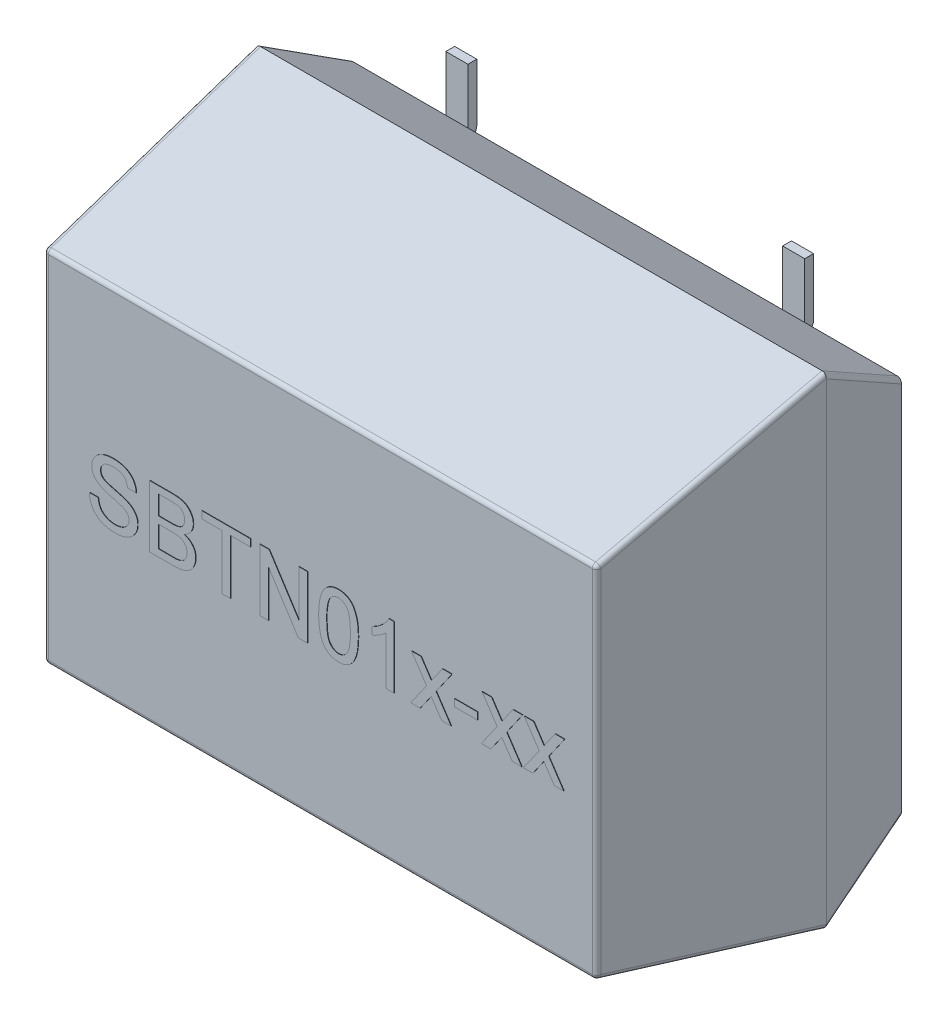
from build123d import *

# Parameters (mm, degrees)
EXTRUDE_1_DEPTH          = 6.45
CUT_EXTRUDE_1_DEPTH      = 12.03245213
CUT_EXTRUDE_1_DEPTH_BACK = 12.03245213
SKETCH_2_OUTSIDE_W       = 18.548
SKETCH_2_OUTSIDE_H       = 12.548
FILLET_1_R               = 0.1
EXTRUDE_2_DEPTH          = 0.25
PATTERN_START            = -1.52
PATTERN_LINEAR_1_DEPTH   = 0.5
SKETCH_4_W               = 0.52051282
SKETCH_4_H               = 0.161538461
EXTRUDE_3_DEPTH          = 0.01


with BuildPart() as part:
    # Эскиз1 → Бобышка-Вытянуть1 (new, symmetric)
    with BuildSketch(Plane(origin=(0, 0, 0), x_dir=(0, 0, -1), z_dir=(1, 0, 0))):
        Polygon((-0.2, -4.3), (-0.2, 4.3), (-2.1, 5.45), (-7.1, 4.05), (-7.1, -4.05), (-2.1, -5.45), align=None)
    extrude(amount=EXTRUDE_1_DEPTH, both=True)

    # Эскиз2 outside → Вырез-Вытянуть1 (cut, two sides: drawn at the far end of the back side and taken through both)
    with BuildSketch(Plane(origin=(0, 0, 0), x_dir=(1, 0, 0), z_dir=(0, 1, 0)).offset(-CUT_EXTRUDE_1_DEPTH_BACK)):
        with Locations((0, -3.65)):
            Rectangle(SKETCH_2_OUTSIDE_W, SKETCH_2_OUTSIDE_H)
        Polygon((-6.45, -2.1), (-6.25, -7.1), (6.25, -7.1), (6.45, -2.1), (6.25, -0.2), (-6.25, -0.2), align=None, mode=Mode.SUBTRACT)
    extrude(amount=CUT_EXTRUDE_1_DEPTH + CUT_EXTRUDE_1_DEPTH_BACK, mode=Mode.SUBTRACT)

    # Скругление1
    # the kernel refuses this fillet: 0.1 mm, written as the material it takes off along each edge
    with BuildSketch(Plane(origin=(6.153920032, -3.97415396, 7), x_dir=(-0.6939297237750098, -0.7200427337745576, 0), z_dir=(0.5236697259500523, -0.5046783631478613, 0.6863452250098288))) as fillet_1_piece_1_section:
        Polygon((-0.189675866, -0.189675866), (0.189675866, -0.189675866), (0.189675866, 0.189675866), (-0.189675866, 0.189675866), align=None)
    fillet_1_piece_1 = extrude(amount=0.189675866, mode=Mode.PRIVATE)
    fillet_1_piece_1 = split(fillet_1_piece_1, bisect_by=Plane(origin=(6.153920032, -3.97415396, 7), z_dir=(1, 0, 0)), keep=Keep.TOP, mode=Mode.PRIVATE)
    fillet_1_piece_1 = split(fillet_1_piece_1, bisect_by=Plane(origin=(6.153920032, -3.97415396, 7), z_dir=(-0.03849001794597494, 0.2694301256218253, 0.9622504486493764)), keep=Keep.TOP, mode=Mode.PRIVATE)
    fillet_1_piece_1 = split(fillet_1_piece_1, bisect_by=Plane(origin=(6.153920032, -3.97415396, 7), z_dir=(0, -1, 0)), keep=Keep.TOP, mode=Mode.PRIVATE)
    fillet_1_piece_1 = split(fillet_1_piece_1, bisect_by=Plane(origin=(6.153920032, -3.97415396, 7.1), z_dir=(0, 0, -1)), keep=Keep.TOP, mode=Mode.PRIVATE)
    fillet_1_piece_1 = split(fillet_1_piece_1, bisect_by=Plane(origin=(6.153920032, -4.070450362, 7.026962993), z_dir=(0, 0.9629640197141818, -0.26962992551997084)), keep=Keep.TOP, mode=Mode.PRIVATE)
    fillet_1_piece_1 = split(fillet_1_piece_1, bisect_by=Plane(origin=(6.253840128, -3.97415396, 7.003996804), z_dir=(-0.9992009587217895, 0, -0.039968038348871464)), keep=Keep.TOP, mode=Mode.PRIVATE)
    fillet_1_piece_1 = fillet_1_piece_1 - Plane(origin=(6.153920032, -3.97415396, 7), x_dir=(-0.5236697259500523, 0.5046783631478613, -0.6863452250098288), z_dir=(-0.6939297237750098, -0.7200427337745576, 0)) * Sphere(FILLET_1_R, mode=Mode.PRIVATE)
    add(fillet_1_piece_1, mode=Mode.SUBTRACT)
    with BuildSketch(Plane(origin=(-6.153920032, -3.97415396, 7), x_dir=(-0.02416515791510732, -0.7965200935815405, -0.6041289478776796), z_dir=(-0.5236697259500523, -0.5046783631478613, 0.6863452250098289))) as fillet_1_piece_2_section:
        Polygon((-0.189675866, -0.189675866), (0.189675866, -0.189675866), (0.189675866, 0.189675866), (-0.189675866, 0.189675866), align=None)
    fillet_1_piece_2 = extrude(amount=0.189675866, mode=Mode.PRIVATE)
    fillet_1_piece_2 = split(fillet_1_piece_2, bisect_by=Plane(origin=(-6.153920032, -3.97415396, 7), z_dir=(0, -1, 0)), keep=Keep.TOP, mode=Mode.PRIVATE)
    fillet_1_piece_2 = split(fillet_1_piece_2, bisect_by=Plane(origin=(-6.153920032, -3.97415396, 7), z_dir=(-1, 0, 0)), keep=Keep.TOP, mode=Mode.PRIVATE)
    fillet_1_piece_2 = split(fillet_1_piece_2, bisect_by=Plane(origin=(-6.153920032, -3.97415396, 7), z_dir=(0.03849001794597527, 0.2694301256218253, 0.9622504486493764)), keep=Keep.TOP, mode=Mode.PRIVATE)
    fillet_1_piece_2 = split(fillet_1_piece_2, bisect_by=Plane(origin=(-6.253840128, -3.97415396, 7.003996804), z_dir=(0.9992009587217895, 0, -0.039968038348871804)), keep=Keep.TOP, mode=Mode.PRIVATE)
    fillet_1_piece_2 = split(fillet_1_piece_2, bisect_by=Plane(origin=(-6.153920032, -3.97415396, 7.1), z_dir=(0, 0, -1)), keep=Keep.TOP, mode=Mode.PRIVATE)
    fillet_1_piece_2 = split(fillet_1_piece_2, bisect_by=Plane(origin=(-6.153920032, -4.070450362, 7.026962993), z_dir=(0, 0.9629640197141818, -0.26962992551997084)), keep=Keep.TOP, mode=Mode.PRIVATE)
    fillet_1_piece_2 = fillet_1_piece_2 - Plane(origin=(-6.153920032, -3.97415396, 7), x_dir=(0.5236697259500523, 0.5046783631478613, -0.6863452250098289), z_dir=(-0.02416515791510732, -0.7965200935815405, -0.6041289478776796)) * Sphere(FILLET_1_R, mode=Mode.PRIVATE)
    add(fillet_1_piece_2, mode=Mode.SUBTRACT)
    with BuildSketch(Plane(origin=(-6.153920032, 3.97415396, 7), x_dir=(0.024165157915107306, -0.7965200935815406, 0.6041289478776792), z_dir=(-0.5236697259500522, 0.5046783631478611, 0.6863452250098291))) as fillet_1_piece_3_section:
        Polygon((-0.189675866, -0.189675866), (0.189675866, -0.189675866), (0.189675866, 0.189675866), (-0.189675866, 0.189675866), align=None)
    fillet_1_piece_3 = extrude(amount=0.189675866, mode=Mode.PRIVATE)
    fillet_1_piece_3 = split(fillet_1_piece_3, bisect_by=Plane(origin=(-6.153920032, 3.97415396, 7), z_dir=(0, 1, 0)), keep=Keep.TOP, mode=Mode.PRIVATE)
    fillet_1_piece_3 = split(fillet_1_piece_3, bisect_by=Plane(origin=(-6.153920032, 3.97415396, 7), z_dir=(-1, 0, 0)), keep=Keep.TOP, mode=Mode.PRIVATE)
    fillet_1_piece_3 = split(fillet_1_piece_3, bisect_by=Plane(origin=(-6.153920032, 3.97415396, 7), z_dir=(0.038490017945975265, -0.26943012562182567, 0.9622504486493763)), keep=Keep.TOP, mode=Mode.PRIVATE)
    fillet_1_piece_3 = split(fillet_1_piece_3, bisect_by=Plane(origin=(-6.253840128, 3.97415396, 7.003996804), z_dir=(0.9992009587217895, 0, -0.039968038348871804)), keep=Keep.TOP, mode=Mode.PRIVATE)
    fillet_1_piece_3 = split(fillet_1_piece_3, bisect_by=Plane(origin=(-6.153920032, 3.97415396, 7.1), z_dir=(0, 0, -1)), keep=Keep.TOP, mode=Mode.PRIVATE)
    fillet_1_piece_3 = split(fillet_1_piece_3, bisect_by=Plane(origin=(-6.153920032, 4.070450362, 7.026962993), z_dir=(0, -0.9629640197141817, -0.2696299255199712)), keep=Keep.TOP, mode=Mode.PRIVATE)
    fillet_1_piece_3 = fillet_1_piece_3 - Plane(origin=(-6.153920032, 3.97415396, 7), x_dir=(0.5236697259500522, -0.5046783631478611, -0.6863452250098291), z_dir=(0.024165157915107306, -0.7965200935815406, 0.6041289478776792)) * Sphere(FILLET_1_R, mode=Mode.PRIVATE)
    add(fillet_1_piece_3, mode=Mode.SUBTRACT)
    with BuildSketch(Plane(origin=(6.153920032, 3.97415396, 7), x_dir=(0.6939297237750099, -0.7200427337745575, 0), z_dir=(0.5236697259500523, 0.5046783631478612, 0.686345225009829))) as fillet_1_piece_4_section:
        Polygon((-0.189675866, -0.189675866), (0.189675866, -0.189675866), (0.189675866, 0.189675866), (-0.189675866, 0.189675866), align=None)
    fillet_1_piece_4 = extrude(amount=0.189675866, mode=Mode.PRIVATE)
    fillet_1_piece_4 = split(fillet_1_piece_4, bisect_by=Plane(origin=(6.153920032, 3.97415396, 7), z_dir=(0, 1, 0)), keep=Keep.TOP, mode=Mode.PRIVATE)
    fillet_1_piece_4 = split(fillet_1_piece_4, bisect_by=Plane(origin=(6.153920032, 3.97415396, 7), z_dir=(-0.03849001794597494, -0.26943012562182567, 0.9622504486493763)), keep=Keep.TOP, mode=Mode.PRIVATE)
    fillet_1_piece_4 = split(fillet_1_piece_4, bisect_by=Plane(origin=(6.153920032, 3.97415396, 7), z_dir=(1, 0, 0)), keep=Keep.TOP, mode=Mode.PRIVATE)
    fillet_1_piece_4 = split(fillet_1_piece_4, bisect_by=Plane(origin=(6.153920032, 3.97415396, 7.1), z_dir=(0, 0, -1)), keep=Keep.TOP, mode=Mode.PRIVATE)
    fillet_1_piece_4 = split(fillet_1_piece_4, bisect_by=Plane(origin=(6.253840128, 3.97415396, 7.003996804), z_dir=(-0.9992009587217895, 0, -0.039968038348871464)), keep=Keep.TOP, mode=Mode.PRIVATE)
    fillet_1_piece_4 = split(fillet_1_piece_4, bisect_by=Plane(origin=(6.153920032, 4.070450362, 7.026962993), z_dir=(0, -0.9629640197141817, -0.2696299255199712)), keep=Keep.TOP, mode=Mode.PRIVATE)
    fillet_1_piece_4 = fillet_1_piece_4 - Plane(origin=(6.153920032, 3.97415396, 7), x_dir=(-0.5236697259500523, -0.5046783631478612, -0.686345225009829), z_dir=(0.6939297237750099, -0.7200427337745575, 0)) * Sphere(FILLET_1_R, mode=Mode.PRIVATE)
    add(fillet_1_piece_4, mode=Mode.SUBTRACT)
    with BuildSketch(Plane(origin=(6.153920032, -4.05, 7.1), x_dir=(0, -0.26962992551997217, -0.9629640197141813), z_dir=(-1, 0, 0)), Plane(origin=(-6.153920032, 4.05, 7.1), x_dir=(0, 0.2696299255199674, -0.9629640197141828), z_dir=(1, 0, 0))) as fillet_1_piece_5:
        with BuildLine():
            CenterArc((FILLET_1_R * 0.75846039886, -FILLET_1_R), FILLET_1_R, 90, 74.357753543)
            Line((-FILLET_1_R * 0.204503620854, -FILLET_1_R * 0.73037007448), (0, 0))
            Line((0, 0), (FILLET_1_R * 0.75846039886, 0))
        make_face()
    extrude(amount=12.307840064, mode=Mode.SUBTRACT)
    with BuildSketch(Plane(origin=(-6.25, -3.97415396, 7.1), x_dir=(-0.03996803834887342, 0, -0.9992009587217894), z_dir=(0, 1, 0))) as fillet_1_piece_6:
        with BuildLine():
            CenterArc((FILLET_1_R * 0.960799680256, -FILLET_1_R), FILLET_1_R, 90, 87.709389957)
            Line((-FILLET_1_R * 0.038401278466, -FILLET_1_R * 0.960031961651), (0, 0))
            Line((0, 0), (FILLET_1_R * 0.960799680256, 0))
        make_face()
    extrude(amount=7.94830792, mode=Mode.SUBTRACT)
    with BuildSketch(Plane(origin=(6.5561911, -6.060598827, 3.108815454), x_dir=(-0.9959697569011013, -0.046441570012610664, 0.07672955045564107), z_dir=(-0.08968970586617502, 0.5157158087305063, -0.8520522057286626)), Plane(origin=(-6.22876178, -4.177880235, -0.001763091), x_dir=(0.9959697569011013, -0.046441570012620684, 0.07672955045563509), z_dir=(-0.0896897058661751, -0.5157158087305062, 0.8520522057286625)), Plane(origin=(-6.5561911, 6.060598827, 3.108815454), x_dir=(0.9959697569011015, 0.04644157001262381, 0.07672955045563323), z_dir=(0.08968970586617511, -0.5157158087305062, -0.8520522057286626))) as fillet_1_piece_7:
        with BuildLine():
            CenterArc((FILLET_1_R * 0.947186519515, FILLET_1_R), FILLET_1_R, 183.107301536, 86.892698464)
            Line((-FILLET_1_R * 0.0513432511233, FILLET_1_R * 0.945793938084), (0, 0))
            Line((0, 0), (FILLET_1_R * 0.947186519515, 0))
        make_face()
    extrude(amount=3.650690091, mode=Mode.SUBTRACT)
    with BuildSketch(Plane(origin=(6.25, -3.97415396, 7.1), x_dir=(0.03996803834887305, 0, -0.9992009587217894), z_dir=(0, 1, 0))) as fillet_1_piece_8:
        with BuildLine():
            CenterArc((FILLET_1_R * 0.960799680256, FILLET_1_R), FILLET_1_R, 182.290610043, 87.709389957)
            Line((-FILLET_1_R * 0.038401278466, FILLET_1_R * 0.960031961651), (0, 0))
            Line((0, 0), (FILLET_1_R * 0.960799680256, 0))
        make_face()
    extrude(amount=7.94830792, mode=Mode.SUBTRACT)
    with BuildSketch(Plane(origin=(6.478558079, 5.649906551, 1.386048031), x_dir=(0.01076859359318294, -0.9630199413342423, -0.26921483982986083), z_dir=(-0.03849001794597494, -0.26943012562182567, 0.9622504486493763))) as fillet_1_piece_9:
        with BuildLine():
            CenterArc((FILLET_1_R * 0.989280867363, -FILLET_1_R), FILLET_1_R, 90, 89.382535542)
            Line((-FILLET_1_R * 0.0106610636213, -FILLET_1_R * 0.989223420797), (0, 0))
            Line((0, 0), (FILLET_1_R * 0.989280867363, 0))
        make_face()
    extrude(amount=5.866021356, mode=Mode.SUBTRACT)
    with BuildSketch(Plane(origin=(-6.252774811, 4.06942368, 7.030629713), x_dir=(0.9992589847074272, 0.010378060672033654, -0.03706450240012789), z_dir=(-0.038490017945975265, 0.26943012562182567, -0.9622504486493763)), Plane(origin=(6.252774811, -4.06942368, 7.030629713), x_dir=(-0.9992589847074272, -0.010378060672022911, -0.03706450240013056), z_dir=(0.03849001794597494, -0.2694301256218253, -0.9622504486493764)), Plane(origin=(-6.478558079, -5.649906551, 1.386048031), x_dir=(0.9992589847074272, -0.010378060672023, -0.03706450240013088), z_dir=(0.03849001794597527, 0.2694301256218253, 0.9622504486493764))) as fillet_1_piece_10:
        with BuildLine():
            CenterArc((FILLET_1_R * 0.989280867363, FILLET_1_R), FILLET_1_R, 180.617464458, 89.382535542)
            Line((-FILLET_1_R * 0.0106610636213, FILLET_1_R * 0.989223420797), (0, 0))
            Line((0, 0), (FILLET_1_R * 0.989280867363, 0))
        make_face()
    extrude(amount=5.866021356, mode=Mode.SUBTRACT)
    with BuildSketch(Plane(origin=(6.22876178, 4.177880235, -0.001763091), x_dir=(0.05398759830949531, -0.8567597123029538, 0.5128821839402616), z_dir=(0.08968970586617502, 0.515715808730506, 0.8520522057286626))) as fillet_1_piece_11:
        with BuildLine():
            CenterArc((FILLET_1_R * 0.947186519515, -FILLET_1_R), FILLET_1_R, 90, 86.892698464)
            Line((-FILLET_1_R * 0.0513432511233, -FILLET_1_R * 0.945793938084), (0, 0))
            Line((0, 0), (FILLET_1_R * 0.947186519515, 0))
        make_face()
    extrude(amount=3.650690091, mode=Mode.SUBTRACT)

    # Эскиз3 → Бобышка-Вытянуть2 (add, symmetric)
    with BuildSketch(Plane(origin=(-3.81, 0, 0), x_dir=(0, 0, -1), z_dir=(1, 0, 0))):
        with BuildLine():
            Line((0, -5.55), (0, -4.25))
            ThreePointArc((0, -4.25), (-0.058578644, -4.108578644), (-0.2, -4.05))
            Line((-0.2, -4.05), (-0.2, -5.55))
            Line((-0.2, -5.55), (0, -5.55))
        make_face()
        with BuildLine():
            Line((0, 4.25), (0, 5.55))
            Line((0, 5.55), (-0.2, 5.55))
            Line((-0.2, 5.55), (-0.2, 4.05))
            ThreePointArc((-0.2, 4.05), (-0.058578644, 4.108578644), (0, 4.25))
        make_face()
    extrude_2 = extrude(amount=EXTRUDE_2_DEPTH, both=True)

    # Зеркальное отражение1: Бобышка-Вытянуть2 across plane
    add(extrude_2.mirror(Plane(origin=(0, 0, 0), x_dir=(0, 0, 1), z_dir=(1, 0, 0))))

    # Линейный массив1: read off the stored shape, not the designer's step
    # Линейный массив1 outline → Линейный массив1 (add)
    with BuildSketch(Plane.YZ.offset(PATTERN_START)):
        with BuildLine():
            ThreePointArc((-4.25, 0), (-4.108578644, 0.058578644), (-4.05, 0.2))
            Line((-4.05, 0.2), (-5.55, 0.2))
            Line((-5.55, 0.2), (-5.55, 0))
            Line((-5.55, 0), (-4.25, 0))
        make_face()
    extrude(amount=PATTERN_LINEAR_1_DEPTH)

    # Эскиз4 → Бобышка-Вытянуть3 (add)
    # profile 1 of 10: a face of its own
    with BuildSketch(Plane.XY.offset(7.1)):
        with BuildLine():
            Line((-5.213856683, -0.21238341), (-5.016420785, -0.21238341))
            add(Edge.make_bspline(
                [(-5.016420785, -0.21238341), (-5.014249105, -0.230110438), (-5.01007719, -0.264165015), (-4.998412099, -0.312432251), (-4.983398375, -0.355829449), (-4.964691689, -0.394932568), (-4.940083755, -0.429272763), (-4.910435428, -0.460247094), (-4.874429149, -0.48706899), (-4.833786267, -0.510938719), (-4.78852144, -0.529680232), (-4.740197199, -0.543573624), (-4.689044011, -0.55180557), (-4.654017455, -0.552867044), (-4.636132324, -0.553409051)],
                knots=[0, 0, 0, 0, 1.125557648, 2.162256852, 3.1243583, 4.018160113, 4.88511607, 5.777380551, 6.711250965, 7.707237736, 8.743031335, 9.791730543, 10.872421559, 12, 12, 12, 12], degree=3))
            add(Edge.make_bspline(
                [(-4.636132324, -0.553409051), (-4.620305523, -0.553116113), (-4.589446326, -0.552544942), (-4.544805048, -0.545683765), (-4.502797476, -0.53595137), (-4.464205415, -0.521229598), (-4.429171226, -0.503352751), (-4.398747957, -0.481730285), (-4.372774189, -0.457346083), (-4.352434846, -0.429557879), (-4.336456664, -0.400440488), (-4.324735016, -0.370510813), (-4.317752671, -0.339934977), (-4.316862938, -0.319361979), (-4.316420785, -0.309138217)],
                knots=[0, 0, 0, 0, 1.267006637, 2.470417599, 3.611360613, 4.716023143, 5.771382139, 6.754486395, 7.697536124, 8.612899418, 9.501261124, 10.352596716, 11.181322154, 12, 12, 12, 12], degree=3))
            add(Edge.make_bspline(
                [(-4.316420785, -0.309138217), (-4.316893455, -0.299018017), (-4.317817287, -0.279238099), (-4.323837646, -0.25044101), (-4.33528019, -0.224083309), (-4.350128204, -0.199089197), (-4.370784328, -0.176237497), (-4.396881009, -0.155181694), (-4.428993223, -0.136092299), (-4.45296016, -0.125637833), (-4.465619503, -0.120115781)],
                knots=[0, 0, 0, 0, 0.942140154, 1.841411588, 2.718743672, 3.605002079, 4.535543111, 5.568170452, 6.715506882, 8, 8, 8, 8], degree=3))
            add(Edge.make_bspline(
                [(-4.465619503, -0.120115781), (-4.470551771, -0.118091742), (-4.481694659, -0.113519068), (-4.500793046, -0.107465636), (-4.523455701, -0.09963793), (-4.550227076, -0.091576667), (-4.580963852, -0.083048978), (-4.615614855, -0.073396927), (-4.654160724, -0.063132499), (-4.695508229, -0.052207134), (-4.737256611, -0.041097713), (-4.777142311, -0.029977888), (-4.813839052, -0.018689841), (-4.847647429, -0.007821011), (-4.878393144, 0.003092661), (-4.906163461, 0.013752381), (-4.930993003, 0.023941878), (-4.946157942, 0.031434059), (-4.953319824, 0.03497236)],
                knots=[0, 0, 0, 0, 0.499201778, 1.127787504, 1.87543728, 2.745208432, 3.745951656, 4.863402235, 6.114490242, 7.482339553, 8.869366102, 10.161191451, 11.360587006, 12.46547846, 13.487450326, 14.41601931, 15.251940103, 16, 16, 16, 16], degree=3))
            add(Edge.make_bspline(
                [(-4.953319824, 0.03497236), (-4.969797316, 0.043873976), (-5.001603165, 0.061056412), (-5.044410315, 0.091778655), (-5.080479685, 0.12587067), (-5.109659104, 0.163283022), (-5.132525873, 0.203382979), (-5.147953983, 0.24623871), (-5.158520964, 0.291072305), (-5.159508476, 0.32190243), (-5.160010529, 0.337576526)],
                knots=[0, 0, 0, 0, 1.158441928, 2.236094408, 3.251151369, 4.220012324, 5.163146324, 6.095083285, 7.031536583, 8, 8, 8, 8], degree=3))
            add(Edge.make_bspline(
                [(-5.160010529, 0.337576526), (-5.159344205, 0.354932941), (-5.158018891, 0.389454723), (-5.146262629, 0.440113286), (-5.127511166, 0.488860298), (-5.106166307, 0.527561266), (-5.085350353, 0.556826765), (-5.068093769, 0.577903243), (-5.048737134, 0.597385612), (-5.027876567, 0.615545835), (-5.005139162, 0.632112577), (-4.981089039, 0.647766709), (-4.954855715, 0.661221811), (-4.917993994, 0.67834712), (-4.868681893, 0.695448341), (-4.806604126, 0.710349887), (-4.741269315, 0.719125097), (-4.696735572, 0.720333044), (-4.673992901, 0.720949924)],
                knots=[0, 0, 0, 0, 1.199927478, 2.386647047, 3.578628709, 4.806592355, 5.433127754, 6.062729195, 6.689531802, 7.331674828, 7.974827539, 8.635320743, 9.315455226, 10.01318112, 11.447700238, 12.918145351, 14.426146008, 16, 16, 16, 16], degree=3))
            add(Edge.make_bspline(
                [(-4.673992901, 0.720949924), (-4.649099536, 0.72037953), (-4.600627358, 0.719268864), (-4.530195914, 0.710028326), (-4.464502658, 0.694159891), (-4.412983753, 0.676396769), (-4.374896429, 0.658414019), (-4.347838133, 0.644382261), (-4.322722684, 0.628158993), (-4.299323992, 0.610602879), (-4.277424714, 0.591721937), (-4.257587712, 0.571067052), (-4.238951608, 0.549342931), (-4.217051588, 0.518153899), (-4.193438724, 0.476875391), (-4.173022188, 0.423397446), (-4.158995791, 0.366955865), (-4.156267333, 0.327936355), (-4.154882324, 0.308129411)],
                knots=[0, 0, 0, 0, 1.607600973, 3.130308851, 4.577334065, 5.967726088, 6.640410691, 7.296826776, 7.935019992, 8.569057421, 9.185393759, 9.8003086, 10.417295362, 11.032210203, 12.259799365, 13.477607022, 14.719591916, 16, 16, 16, 16], degree=3))
            Line((-4.154882324, 0.308129411), (-4.352318221, 0.308129411))
            add(Edge.make_bspline(
                [(-4.352318221, 0.308129411), (-4.3535727, 0.318154284), (-4.356027343, 0.337769991), (-4.362116986, 0.366166676), (-4.37065344, 0.39254024), (-4.380652244, 0.417136633), (-4.392772887, 0.439700027), (-4.40690205, 0.460447078), (-4.423211796, 0.479133351), (-4.441282458, 0.49625261), (-4.461663923, 0.511158705), (-4.484251464, 0.524097654), (-4.50908321, 0.535028102), (-4.536137285, 0.543980496), (-4.565419044, 0.550921832), (-4.596995089, 0.556028012), (-4.630853215, 0.558643115), (-4.65417078, 0.559150835), (-4.666140337, 0.559411462)],
                knots=[0, 0, 0, 0, 1.074487479, 2.102453544, 3.083708351, 4.020042547, 4.923259678, 5.803182661, 6.684453325, 7.556870173, 8.445961597, 9.363679789, 10.320905216, 11.327237703, 12.390948353, 13.519046902, 14.726457512, 16, 16, 16, 16], degree=3))
            add(Edge.make_bspline(
                [(-4.666140337, 0.559411462), (-4.678582133, 0.559317682), (-4.70266639, 0.559136146), (-4.737482914, 0.555826976), (-4.769753333, 0.551286678), (-4.799422216, 0.544589352), (-4.826392374, 0.53582253), (-4.851064081, 0.525698861), (-4.872746875, 0.51286953), (-4.891946217, 0.498579323), (-4.908508082, 0.482767999), (-4.922781956, 0.466106685), (-4.935406095, 0.449084905), (-4.94521533, 0.430772235), (-4.953201521, 0.411862205), (-4.958353492, 0.391999368), (-4.962001208, 0.371551135), (-4.962380849, 0.357598896), (-4.962574631, 0.350477167)],
                knots=[0, 0, 0, 0, 1.464176581, 2.834285765, 4.113735764, 5.29917439, 6.409476712, 7.449999357, 8.431575861, 9.367089851, 10.262376129, 11.120706676, 11.948504824, 12.751342953, 13.560717798, 14.359016663, 15.162382702, 16, 16, 16, 16], degree=3))
            add(Edge.make_bspline(
                [(-4.962574631, 0.350477167), (-4.962064411, 0.338432183), (-4.961074119, 0.315053978), (-4.950961794, 0.281840597), (-4.935408967, 0.251564447), (-4.920086955, 0.235091349), (-4.912374311, 0.226799283)],
                knots=[0, 0, 0, 0, 1.050964922, 2.039826012, 3.013306874, 4, 4, 4, 4], degree=3))
            add(Edge.make_bspline(
                [(-4.912374311, 0.226799283), (-4.907512342, 0.222655305), (-4.896760399, 0.213491153), (-4.876754751, 0.201363472), (-4.851950715, 0.189109995), (-4.822182553, 0.176929091), (-4.787501484, 0.164672885), (-4.747963448, 0.152053614), (-4.703417849, 0.139520318), (-4.655222214, 0.127442414), (-4.606533385, 0.115315955), (-4.560262628, 0.103235714), (-4.517778241, 0.09178697), (-4.479147629, 0.080620596), (-4.444330807, 0.069768166), (-4.413448777, 0.059002307), (-4.386251691, 0.049100448), (-4.369590263, 0.042133681), (-4.361853478, 0.038898642)],
                knots=[0, 0, 0, 0, 0.523891492, 1.158553688, 1.913783773, 2.794766643, 3.797521443, 4.933638669, 6.202080764, 7.596537849, 9.013317056, 10.322179469, 11.523240428, 12.626146501, 13.623953177, 14.517289671, 15.311498917, 16, 16, 16, 16], degree=3))
            add(Edge.make_bspline(
                [(-4.361853478, 0.038898642), (-4.351787527, 0.034257592), (-4.332029754, 0.02514799), (-4.304040222, 0.009594714), (-4.277922953, -0.006556525), (-4.253888955, -0.023740574), (-4.232015943, -0.041993579), (-4.212059351, -0.061106401), (-4.193898648, -0.080971622), (-4.178266617, -0.102225045), (-4.164230656, -0.124007512), (-4.151948256, -0.146623459), (-4.142058703, -0.170205888), (-4.133384949, -0.194470534), (-4.127146032, -0.219687289), (-4.122253462, -0.245601449), (-4.119399708, -0.272334818), (-4.119124357, -0.290435002), (-4.118984888, -0.299602961)],
                knots=[0, 0, 0, 0, 1.198900896, 2.353241543, 3.461831299, 4.520043694, 5.547003373, 6.541368882, 7.508191797, 8.454912692, 9.392021408, 10.310662301, 11.235020644, 12.156274873, 13.095836685, 14.042125239, 15.00831306, 16, 16, 16, 16], degree=3))
            add(Edge.make_bspline(
                [(-4.118984888, -0.299602961), (-4.119715521, -0.317899716), (-4.121166072, -0.354224855), (-4.133655833, -0.407769791), (-4.153276587, -0.459654535), (-4.176286782, -0.500827938), (-4.198038371, -0.532278434), (-4.216310731, -0.554883613), (-4.236573729, -0.575785546), (-4.258328509, -0.59563905), (-4.281743976, -0.61403905), (-4.307017538, -0.63099181), (-4.333882444, -0.646673807), (-4.372244855, -0.66578324), (-4.423196509, -0.685773521), (-4.488098688, -0.70242075), (-4.556497723, -0.713220219), (-4.603464723, -0.714363791), (-4.627438413, -0.714947512)],
                knots=[0, 0, 0, 0, 1.197055466, 2.376552968, 3.581957237, 4.820753935, 5.454298064, 6.085440993, 6.72202542, 7.359198513, 8.013298489, 8.67051481, 9.351020706, 10.049282741, 11.476266879, 12.925760103, 14.430794493, 16, 16, 16, 16], degree=3))
            add(Edge.make_bspline(
                [(-4.627438413, -0.714947512), (-4.642681383, -0.71482172), (-4.672540184, -0.714575312), (-4.716414356, -0.711591228), (-4.758459777, -0.707274604), (-4.798635185, -0.700844944), (-4.836814595, -0.69240958), (-4.873135052, -0.682280337), (-4.907682647, -0.670614427), (-4.940336669, -0.656895518), (-4.971011877, -0.640955644), (-5.000259844, -0.623760554), (-5.02760249, -0.604269113), (-5.053097377, -0.5827876), (-5.077390489, -0.559936596), (-5.099474951, -0.534782886), (-5.120101577, -0.508062055), (-5.138799055, -0.479529543), (-5.155502404, -0.44955865), (-5.170523475, -0.418652704), (-5.183178937, -0.386587508), (-5.193378035, -0.353525118), (-5.202017187, -0.319686789), (-5.20800824, -0.284790197), (-5.212413063, -0.248944907), (-5.213372634, -0.224642561), (-5.213856683, -0.21238341)],
                knots=[0, 0, 0, 0, 1.259822038, 2.467811403, 3.633536148, 4.752793854, 5.829021491, 6.863980041, 7.868367876, 8.841470325, 9.788447787, 10.724101269, 11.643985084, 12.560193707, 13.478453146, 14.398077254, 15.323914234, 16.266973849, 17.21495974, 18.158525798, 19.105629373, 20.061269543, 21.017128399, 21.990322895, 22.986232211, 24, 24, 24, 24], degree=3))
        make_face()
    # profile 2 of 10: a face of its own
    with BuildSketch(Plane.XY.offset(7.1)):
        with BuildLine():
            Line((-3.849754119, -0.696998794), (-3.849754119, 0.703001206))
            Line((-3.849754119, 0.703001206), (-3.325595465, 0.703001206))
            add(Edge.make_bspline(
                [(-3.325595465, 0.703001206), (-3.312597197, 0.702951341), (-3.287233882, 0.702854042), (-3.250198196, 0.700420674), (-3.215122637, 0.697092333), (-3.181931694, 0.692801998), (-3.150768983, 0.68657681), (-3.121663546, 0.679035411), (-3.094463918, 0.670336651), (-3.061216518, 0.657085621), (-3.022902534, 0.63668947), (-2.981864618, 0.606255194), (-2.946160036, 0.569714545), (-2.916780416, 0.527818623), (-2.892574778, 0.483065876), (-2.875413264, 0.436308887), (-2.864440978, 0.388565671), (-2.863196045, 0.356237356), (-2.862574631, 0.340100565)],
                knots=[0, 0, 0, 0, 0.939712594, 1.833646414, 2.682508961, 3.487467313, 4.25240329, 4.978730417, 5.660668875, 6.315918528, 7.564895217, 8.787077865, 9.996481721, 11.241996224, 12.475862915, 13.665015424, 14.834484263, 16, 16, 16, 16], degree=3))
            add(Edge.make_bspline(
                [(-2.862574631, 0.340100565), (-2.863227868, 0.325087469), (-2.864528043, 0.295206018), (-2.874875981, 0.251188823), (-2.891208193, 0.208448401), (-2.914302403, 0.167504346), (-2.943819699, 0.129105721), (-2.980412716, 0.094551717), (-3.023555617, 0.06376828), (-3.055934363, 0.047359804), (-3.072630721, 0.038898642)],
                knots=[0, 0, 0, 0, 0.926741525, 1.844548388, 2.778836836, 3.746021974, 4.738420572, 5.759761325, 6.844803049, 8, 8, 8, 8], degree=3))
            add(Edge.make_bspline(
                [(-3.072630721, 0.038898642), (-3.062302243, 0.035665385), (-3.04208084, 0.029335219), (-3.013010473, 0.017751903), (-2.985722277, 0.004562639), (-2.960156852, -0.010254245), (-2.936486941, -0.026835962), (-2.914779332, -0.045208361), (-2.894883514, -0.065087134), (-2.876835033, -0.08646019), (-2.860981335, -0.109189987), (-2.846762549, -0.132779743), (-2.835021293, -0.157513531), (-2.825397414, -0.183327134), (-2.817889357, -0.210061048), (-2.812497756, -0.237818096), (-2.80942468, -0.266533668), (-2.808963114, -0.28604074), (-2.808728478, -0.295957127)],
                knots=[0, 0, 0, 0, 1.127427615, 2.20731145, 3.257257018, 4.283066884, 5.282973838, 6.264540225, 7.242620376, 8.210460609, 9.17525685, 10.12748095, 11.077310519, 12.023587065, 12.994999128, 13.967387486, 14.966724908, 16, 16, 16, 16], degree=3))
            add(Edge.make_bspline(
                [(-2.808728478, -0.295957127), (-2.809212099, -0.311877748), (-2.810170695, -0.343434355), (-2.817869292, -0.389880375), (-2.830879511, -0.434557531), (-2.848786972, -0.476743448), (-2.870124433, -0.515750539), (-2.894375204, -0.550557471), (-2.920920842, -0.580806084), (-2.950508844, -0.606250574), (-2.982948354, -0.6278455), (-3.019155602, -0.64602984), (-3.05885064, -0.662066686), (-3.102840247, -0.67487751), (-3.151104399, -0.685054411), (-3.204298085, -0.691666361), (-3.26250303, -0.696399631), (-3.303055125, -0.696793491), (-3.324193221, -0.696998794)],
                knots=[0, 0, 0, 0, 1.028073207, 2.037766189, 3.031549473, 4.027532207, 4.992436545, 5.898794514, 6.762903869, 7.584966804, 8.412380356, 9.273953678, 10.198004568, 11.174406109, 12.229717296, 13.381036288, 14.634844708, 16, 16, 16, 16], degree=3))
            Line((-3.324193221, -0.696998794), (-3.849754119, -0.696998794))
        make_face()
        with BuildLine():
            Line((-3.652318221, 0.110693514), (-3.36373649, 0.110693514))
            add(Edge.make_bspline(
                [(-3.36373649, 0.110693514), (-3.354293378, 0.110730874), (-3.336151025, 0.110802652), (-3.309981114, 0.111803452), (-3.28582754, 0.112657277), (-3.263783733, 0.114800312), (-3.243740486, 0.116899321), (-3.225778009, 0.119724913), (-3.209808322, 0.122908714), (-3.200030081, 0.125861929), (-3.19546726, 0.127239988)],
                knots=[0, 0, 0, 0, 1.335841395, 2.566453063, 3.705076039, 4.753984432, 5.69893722, 6.555639608, 7.326018133, 8, 8, 8, 8], degree=3))
            add(Edge.make_bspline(
                [(-3.19546726, 0.127239988), (-3.184746267, 0.130995553), (-3.164078436, 0.138235495), (-3.13638161, 0.154678133), (-3.112791965, 0.174409218), (-3.093372715, 0.197777152), (-3.078449984, 0.224656881), (-3.06738521, 0.254490984), (-3.061327001, 0.287696513), (-3.060461282, 0.310723382), (-3.060010529, 0.322712744)],
                knots=[0, 0, 0, 0, 1.059015028, 2.041559358, 2.989777133, 3.920090524, 4.862499371, 5.848878527, 6.879979022, 8, 8, 8, 8], degree=3))
            add(Edge.make_bspline(
                [(-3.060010529, 0.322712744), (-3.060372965, 0.334235298), (-3.06107931, 0.356691425), (-3.067008447, 0.389301616), (-3.077268599, 0.41963941), (-3.091163655, 0.447698152), (-3.108758488, 0.472660434), (-3.129758534, 0.494122153), (-3.154915108, 0.510346268), (-3.178428969, 0.520466904), (-3.199577823, 0.526798317), (-3.218473582, 0.530544353), (-3.239907008, 0.533844984), (-3.263948633, 0.53665107), (-3.290607552, 0.538828852), (-3.319965905, 0.540558955), (-3.351953806, 0.541293515), (-3.374112922, 0.54140493), (-3.38561149, 0.541462744)],
                knots=[0, 0, 0, 0, 1.216168307, 2.37017178, 3.484610845, 4.588286376, 5.664695412, 6.69777344, 7.738183022, 8.803673002, 9.390844981, 10.0665252, 10.835811589, 11.680682236, 12.621801058, 13.660007223, 14.785756265, 16, 16, 16, 16], degree=3))
            Line((-3.38561149, 0.541462744), (-3.652318221, 0.541462744))
            Line((-3.652318221, 0.541462744), (-3.652318221, 0.110693514))
        make_face(mode=Mode.SUBTRACT)
        with BuildLine():
            Line((-3.652318221, -0.535460333), (-3.321108285, -0.535460333))
            add(Edge.make_bspline(
                [(-3.321108285, -0.535460333), (-3.307926894, -0.535308897), (-3.283709041, -0.535030668), (-3.25058375, -0.534157851), (-3.223808274, -0.532025884), (-3.208172811, -0.529730301), (-3.201356683, -0.528729563)],
                knots=[0, 0, 0, 0, 1.317581857, 2.420761387, 3.311546315, 4, 4, 4, 4], degree=3))
            add(Edge.make_bspline(
                [(-3.201356683, -0.528729563), (-3.191584379, -0.526675524), (-3.172662672, -0.522698373), (-3.145987606, -0.513821787), (-3.121529942, -0.503653184), (-3.099716553, -0.49073002), (-3.079517877, -0.475836959), (-3.061963725, -0.457234812), (-3.045795518, -0.436099624), (-3.03178719, -0.411912805), (-3.020459423, -0.38515574), (-3.011801804, -0.356241843), (-3.007190126, -0.325272493), (-3.006511117, -0.304010352), (-3.006164375, -0.29315264)],
                knots=[0, 0, 0, 0, 1.067651492, 2.067249321, 3.003744366, 3.895862395, 4.774133402, 5.679610569, 6.621910665, 7.616993802, 8.661192143, 9.724711987, 10.838102842, 12, 12, 12, 12], degree=3))
            add(Edge.make_bspline(
                [(-3.006164375, -0.29315264), (-3.006550683, -0.280405036), (-3.007304024, -0.255545907), (-3.014464786, -0.219623206), (-3.026293192, -0.186304454), (-3.042944142, -0.156051083), (-3.0633674, -0.12884078), (-3.088077481, -0.10575902), (-3.116889618, -0.087442503), (-3.149892361, -0.073067581), (-3.188465957, -0.062840072), (-3.233675346, -0.055901327), (-3.286243667, -0.051423921), (-3.323808898, -0.051046205), (-3.343824631, -0.050844948)],
                knots=[0, 0, 0, 0, 0.96167883, 1.875371887, 2.752872588, 3.621584364, 4.472914353, 5.312011319, 6.159851575, 7.038572308, 8.019870099, 9.164119506, 10.488969081, 12, 12, 12, 12], degree=3))
            Line((-3.343824631, -0.050844948), (-3.652318221, -0.050844948))
            Line((-3.652318221, -0.050844948), (-3.652318221, -0.535460333))
        make_face(mode=Mode.SUBTRACT)
    # profile 3 of 10: a face of its own
    with BuildSketch(Plane.XY.offset(7.1)):
        Polygon((-2.216420785, -0.696998794), (-2.216420785, 0.541462744), (-2.665138734, 0.541462744), (-2.665138734, 0.703001206), (-1.570266939, 0.703001206), (-1.570266939, 0.541462744), (-2.018984888, 0.541462744), (-2.018984888, -0.696998794), align=None)
    # profile 4 of 10: a face of its own
    with BuildSketch(Plane.XY.offset(7.1)):
        Polygon((-1.354882324, -0.696998794), (-1.354882324, 0.703001206), (-1.146228478, 0.703001206), (-0.475395144, -0.341670268), (-0.475395144, 0.703001206), (-0.277959247, 0.703001206), (-0.277959247, -0.696998794), (-0.486613093, -0.696998794), (-1.157446426, 0.34767268), (-1.157446426, -0.696998794), align=None)
    # profile 5 of 10: a face of its own
    with BuildSketch(Plane.XY.offset(7.1)):
        with BuildLine():
            add(Edge.make_bspline(
                [(-0.026677196, -0.006534051), (-0.026496362, 0.013473235), (-0.026142186, 0.052659081), (-0.023945344, 0.109995013), (-0.020109838, 0.164444574), (-0.014384482, 0.215960477), (-0.007604588, 0.264659002), (0.001209318, 0.310470653), (0.011126242, 0.353498216), (0.023024772, 0.39369684), (0.036097361, 0.431412161), (0.05092863, 0.466583674), (0.06761582, 0.499174091), (0.085338859, 0.529521392), (0.105030724, 0.557153551), (0.125502854, 0.582846039), (0.14824304, 0.605656614), (0.172305697, 0.626172193), (0.198045154, 0.644275996), (0.225325223, 0.659897395), (0.254040939, 0.673689963), (0.284739591, 0.684073005), (0.316783881, 0.692537385), (0.350420469, 0.698763886), (0.385686422, 0.702434618), (0.409785744, 0.70281021), (0.422040753, 0.703001206)],
                knots=[0, 0, 0, 0, 1.514747001, 2.966751498, 4.343369068, 5.64627492, 6.890416844, 8.064737671, 9.177176366, 10.232018008, 11.237056675, 12.19799043, 13.119080079, 14.007588942, 14.855863561, 15.685992447, 16.491747269, 17.290132607, 18.077525251, 18.870243746, 19.668095604, 20.485086593, 21.319398728, 22.175900658, 23.072407314, 24, 24, 24, 24], degree=3))
            add(Edge.make_bspline(
                [(0.422040753, 0.703001206), (0.440020446, 0.702472616), (0.475342274, 0.701434179), (0.526912324, 0.692964877), (0.575513774, 0.678476832), (0.621115045, 0.658931833), (0.662936592, 0.634105923), (0.700284996, 0.603926247), (0.732757395, 0.568709686), (0.759999402, 0.528038935), (0.783811635, 0.483035964), (0.8049659, 0.433498785), (0.824088742, 0.379482908), (0.837658726, 0.331131158), (0.847338185, 0.289392212), (0.853745218, 0.25496711), (0.859064339, 0.217822231), (0.863139505, 0.178047438), (0.866483083, 0.135687343), (0.869065174, 0.090715572), (0.87037585, 0.043019724), (0.870628692, 0.010293532), (0.870758702, -0.006534051)],
                knots=[0, 0, 0, 0, 1.134486744, 2.228744715, 3.287356444, 4.328707449, 5.352829806, 6.347195599, 7.349461267, 8.364207941, 9.428085653, 10.559314403, 11.761222316, 13.04268526, 13.726896727, 14.465273606, 15.252205015, 16.094778733, 16.988606776, 17.934225168, 18.937792761, 20, 20, 20, 20], degree=3))
            add(Edge.make_bspline(
                [(0.870758702, -0.006534051), (0.870574481, -0.026447358), (0.87021457, -0.065351925), (0.868076594, -0.12222812), (0.864009971, -0.176266886), (0.859005917, -0.227592009), (0.851435831, -0.276066476), (0.843278654, -0.321896242), (0.83319024, -0.3648732), (0.82141943, -0.405016185), (0.808162825, -0.442537458), (0.793624907, -0.477720586), (0.777522766, -0.510541526), (0.759377142, -0.54068016), (0.740018281, -0.568536527), (0.719304398, -0.594215124), (0.696796335, -0.617346361), (0.672516836, -0.637800404), (0.646958102, -0.656225252), (0.61961171, -0.672000881), (0.590597349, -0.685070715), (0.560108878, -0.696244774), (0.527836944, -0.704432469), (0.494036044, -0.710700022), (0.458581634, -0.71439081), (0.434389098, -0.714759385), (0.422040753, -0.714947512)],
                knots=[0, 0, 0, 0, 1.508974709, 2.94807912, 4.311757619, 5.615040294, 6.854280449, 8.028314546, 9.141715822, 10.197470207, 11.196696834, 12.155719058, 13.080757287, 13.963948316, 14.818758719, 15.649605906, 16.461113142, 17.260189315, 18.052359509, 18.845763934, 19.647754795, 20.461145776, 21.303032214, 22.167241874, 23.064524267, 24, 24, 24, 24], degree=3))
            add(Edge.make_bspline(
                [(0.422040753, -0.714947512), (0.405850641, -0.714485688), (0.374284377, -0.713585259), (0.328184178, -0.707467396), (0.284916681, -0.696699671), (0.244116951, -0.682258632), (0.206243588, -0.662942912), (0.171115762, -0.639441567), (0.138027604, -0.61230138), (0.118980049, -0.590888395), (0.109340433, -0.580051679)],
                knots=[0, 0, 0, 0, 1.10322584, 2.150986741, 3.161425019, 4.136713905, 5.093944212, 6.049774532, 7.013026876, 8, 8, 8, 8], degree=3))
            add(Edge.make_bspline(
                [(0.109340433, -0.580051679), (0.098245013, -0.564046373), (0.075365782, -0.531042746), (0.048587625, -0.474768501), (0.024701036, -0.412818459), (0.005954443, -0.343977167), (-0.008728813, -0.268792523), (-0.01933379, -0.187117), (-0.025335162, -0.098985884), (-0.026219753, -0.03804701), (-0.026677196, -0.006534051)],
                knots=[0, 0, 0, 0, 0.779365345, 1.607084704, 2.489375761, 3.438383567, 4.461919411, 5.557722155, 6.737039282, 8, 8, 8, 8], degree=3))
        make_face()
        with BuildLine():
            add(Edge.make_bspline(
                [(0.152809984, -0.005973153), (0.1529882, -0.032900245), (0.153329346, -0.084444656), (0.156893492, -0.158084739), (0.163029021, -0.224518145), (0.171140592, -0.283652895), (0.18185115, -0.335568978), (0.195299523, -0.380134097), (0.210459037, -0.417883133), (0.229218649, -0.448348218), (0.249758351, -0.473181706), (0.270964191, -0.49453931), (0.293335067, -0.512692783), (0.316725012, -0.527829078), (0.341496939, -0.539289286), (0.36737997, -0.54759567), (0.394379738, -0.552375867), (0.412767807, -0.553062691), (0.422040753, -0.553409051)],
                knots=[0, 0, 0, 0, 1.89448813, 3.626469325, 5.185477471, 6.587276848, 7.82441448, 8.910550357, 9.859733512, 10.6775885, 11.416198291, 12.123144072, 12.791880183, 13.439617036, 14.078171869, 14.70637855, 15.347637704, 16, 16, 16, 16], degree=3))
            add(Edge.make_bspline(
                [(0.422040753, -0.553409051), (0.431311378, -0.553055123), (0.449694842, -0.552353291), (0.476756995, -0.547678503), (0.502539321, -0.538944512), (0.527274313, -0.527524781), (0.550834264, -0.512733488), (0.57309527, -0.494511445), (0.594412817, -0.473166523), (0.614860256, -0.448044391), (0.633476946, -0.417438456), (0.648920834, -0.379720169), (0.662159621, -0.335077004), (0.67292895, -0.283187372), (0.681073982, -0.224146119), (0.687172416, -0.157896968), (0.690760413, -0.084351636), (0.691095929, -0.032900367), (0.691271522, -0.005973153)],
                knots=[0, 0, 0, 0, 0.652509534, 1.29391342, 1.924290653, 2.562989607, 3.207355802, 3.876242846, 4.583348185, 5.32723334, 6.150888545, 7.094226006, 8.186903555, 9.424320409, 10.81992305, 12.379283064, 14.105084285, 16, 16, 16, 16], degree=3))
            add(Edge.make_bspline(
                [(0.691271522, -0.005973153), (0.691101551, 0.020393792), (0.690775893, 0.070911862), (0.687095356, 0.143133267), (0.681327624, 0.208451616), (0.673438282, 0.266927127), (0.662953349, 0.318496316), (0.650236555, 0.363268968), (0.635082594, 0.401149597), (0.617064588, 0.432518715), (0.597006943, 0.458249901), (0.576054831, 0.480522482), (0.553684447, 0.499464587), (0.529499455, 0.514660223), (0.504279384, 0.526919496), (0.477444741, 0.535356641), (0.449259287, 0.540540158), (0.429915976, 0.541151702), (0.420077612, 0.541462744)],
                knots=[0, 0, 0, 0, 1.850066095, 3.544656626, 5.0727657, 6.45041401, 7.682899467, 8.762389858, 9.712573485, 10.538438529, 11.291566246, 11.996865408, 12.681389046, 13.341983376, 13.996294293, 14.643563182, 15.31009126, 16, 16, 16, 16], degree=3))
            add(Edge.make_bspline(
                [(0.420077612, 0.541462744), (0.410805248, 0.541219381), (0.392521334, 0.540739501), (0.365751289, 0.536159046), (0.340381632, 0.528499504), (0.316121709, 0.51812391), (0.293577155, 0.504160411), (0.27185391, 0.487857031), (0.251969407, 0.467993183), (0.239987179, 0.453143281), (0.233859663, 0.445549283)],
                knots=[0, 0, 0, 0, 1.021318143, 2.013908504, 2.982026795, 3.937174072, 4.91255697, 5.897578595, 6.924855925, 8, 8, 8, 8], degree=3))
            add(Edge.make_bspline(
                [(0.233859663, 0.445549283), (0.227188668, 0.434396051), (0.21310093, 0.410842775), (0.19733757, 0.36990621), (0.183412841, 0.323123509), (0.171948173, 0.269774885), (0.163654289, 0.209951853), (0.157106589, 0.143723886), (0.153705302, 0.070998521), (0.153116657, 0.020391963), (0.152809984, -0.005973153)],
                knots=[0, 0, 0, 0, 0.671104906, 1.417232262, 2.260109084, 3.195198885, 4.23592645, 5.382417421, 6.636286093, 8, 8, 8, 8], degree=3))
        make_face(mode=Mode.SUBTRACT)
    # profile 6 of 10: a face of its own
    with BuildSketch(Plane.XY.offset(7.1)):
        with BuildLine():
            Line((1.67845101, -0.696998794), (1.49896383, -0.696998794))
            Line((1.49896383, -0.696998794), (1.49896383, 0.393946719))
            add(Edge.make_bspline(
                [(1.49896383, 0.393946719), (1.488628942, 0.383979991), (1.467149011, 0.36326524), (1.430839456, 0.333948694), (1.390313352, 0.304235133), (1.346096957, 0.275662221), (1.301025823, 0.248763907), (1.257470374, 0.224573008), (1.216157787, 0.204101639), (1.188944963, 0.192907813), (1.175886907, 0.187536462)],
                knots=[0, 0, 0, 0, 0.893362401, 1.856755847, 2.901947673, 4.020460078, 5.132200827, 6.168787962, 7.121294059, 8, 8, 8, 8], degree=3))
            Line((1.175886907, 0.187536462), (1.175886907, 0.353001206))
            add(Edge.make_bspline(
                [(1.175886907, 0.353001206), (1.198315468, 0.36455196), (1.242520834, 0.387317812), (1.304973458, 0.426637568), (1.3632797, 0.469261802), (1.416474361, 0.515181078), (1.464159986, 0.56211882), (1.504345354, 0.609480846), (1.537969913, 0.655531068), (1.554839991, 0.687645991), (1.562906138, 0.703001206)],
                knots=[0, 0, 0, 0, 1.141258006, 2.249351951, 3.335817539, 4.406819942, 5.426913362, 6.360259544, 7.215985427, 8, 8, 8, 8], degree=3))
            Line((1.562906138, 0.703001206), (1.67845101, 0.703001206))
            Line((1.67845101, 0.703001206), (1.67845101, -0.696998794))
        make_face()
    # profile 7 of 10: a face of its own
    with BuildSketch(Plane.XY.offset(7.1)):
        with BuildLine():
            Line((2.055374087, -0.696998794), (2.414348445, -0.185460333))
            Line((2.414348445, -0.185460333), (2.073322804, 0.326078129))
            Line((2.073322804, 0.326078129), (2.288426971, 0.326078129))
            Line((2.288426971, 0.326078129), (2.454172163, 0.077881014))
            add(Edge.make_bspline(
                [(2.454172163, 0.077881014), (2.461135757, 0.067285491), (2.474308446, 0.047242458), (2.493613861, 0.019449537), (2.509749909, -0.005504191), (2.520055392, -0.020758266), (2.52484524, -0.027848153)],
                knots=[0, 0, 0, 0, 1.196313644, 2.263008139, 3.192669756, 4, 4, 4, 4], degree=3))
            add(Edge.make_bspline(
                [(2.52484524, -0.027848153), (2.536348334, -0.011491941), (2.559279607, 0.021113964), (2.582154897, 0.05375917), (2.593555176, 0.070028449)],
                knots=[0, 0, 0, 0, 1.003266858, 2, 2, 2, 2], degree=3))
            Line((2.593555176, 0.070028449), (2.773322804, 0.326078129))
            Line((2.773322804, 0.326078129), (2.988146522, 0.326078129))
            Line((2.988146522, 0.326078129), (2.629452612, -0.185179884))
            Line((2.629452612, -0.185179884), (2.970758702, -0.696998794))
            Line((2.970758702, -0.696998794), (2.755654535, -0.696998794))
            Line((2.755654535, -0.696998794), (2.556535945, -0.39832091))
            Line((2.556535945, -0.39832091), (2.518955817, -0.342792063))
            Line((2.518955817, -0.342792063), (2.270478253, -0.696998794))
            Line((2.270478253, -0.696998794), (2.055374087, -0.696998794))
        make_face()
    # profile 8 of 10: a face of its own
    with BuildSketch(Plane.XY.offset(7.1)):
        with Locations((3.302809984, -0.203409051)):
            Rectangle(SKETCH_4_W, SKETCH_4_H)
    # profile 9 of 10: a face of its own
    with BuildSketch(Plane.XY.offset(7.1)):
        with BuildLine():
            Line((3.652809984, -0.696998794), (4.011784343, -0.185460333))
            Line((4.011784343, -0.185460333), (3.670758702, 0.326078129))
            Line((3.670758702, 0.326078129), (3.885862869, 0.326078129))
            Line((3.885862869, 0.326078129), (4.051608061, 0.077881014))
            add(Edge.make_bspline(
                [(4.051608061, 0.077881014), (4.058571654, 0.067285491), (4.071744343, 0.047242458), (4.091049759, 0.019449537), (4.107185806, -0.005504191), (4.117491289, -0.020758266), (4.122281138, -0.027848153)],
                knots=[0, 0, 0, 0, 1.196313644, 2.263008139, 3.192669756, 4, 4, 4, 4], degree=3))
            add(Edge.make_bspline(
                [(4.122281138, -0.027848153), (4.133784231, -0.011491941), (4.156715504, 0.021113964), (4.179590794, 0.05375917), (4.190991074, 0.070028449)],
                knots=[0, 0, 0, 0, 1.003266858, 2, 2, 2, 2], degree=3))
            Line((4.190991074, 0.070028449), (4.370758702, 0.326078129))
            Line((4.370758702, 0.326078129), (4.58558242, 0.326078129))
            Line((4.58558242, 0.326078129), (4.22688851, -0.185179884))
            Line((4.22688851, -0.185179884), (4.568194599, -0.696998794))
            Line((4.568194599, -0.696998794), (4.353090433, -0.696998794))
            Line((4.353090433, -0.696998794), (4.153971843, -0.39832091))
            Line((4.153971843, -0.39832091), (4.116391715, -0.342792063))
            Line((4.116391715, -0.342792063), (3.867914151, -0.696998794))
            Line((3.867914151, -0.696998794), (3.652809984, -0.696998794))
        make_face()
    # profile 10 of 10: a face of its own
    with BuildSketch(Plane.XY.offset(7.1)):
        with BuildLine():
            Line((4.604092035, -0.696998794), (4.963066394, -0.185460333))
            Line((4.963066394, -0.185460333), (4.622040753, 0.326078129))
            Line((4.622040753, 0.326078129), (4.83714492, 0.326078129))
            Line((4.83714492, 0.326078129), (5.002890112, 0.077881014))
            add(Edge.make_bspline(
                [(5.002890112, 0.077881014), (5.009853705, 0.067285491), (5.023026395, 0.047242458), (5.04233181, 0.019449537), (5.058467858, -0.005504191), (5.06877334, -0.020758266), (5.073563189, -0.027848153)],
                knots=[0, 0, 0, 0, 1.196313644, 2.263008139, 3.192669756, 4, 4, 4, 4], degree=3))
            add(Edge.make_bspline(
                [(5.073563189, -0.027848153), (5.085066282, -0.011491941), (5.107997556, 0.021113964), (5.130872845, 0.05375917), (5.142273125, 0.070028449)],
                knots=[0, 0, 0, 0, 1.003266858, 2, 2, 2, 2], degree=3))
            Line((5.142273125, 0.070028449), (5.322040753, 0.326078129))
            Line((5.322040753, 0.326078129), (5.536864471, 0.326078129))
            Line((5.536864471, 0.326078129), (5.178170561, -0.185179884))
            Line((5.178170561, -0.185179884), (5.519476651, -0.696998794))
            Line((5.519476651, -0.696998794), (5.304372484, -0.696998794))
            Line((5.304372484, -0.696998794), (5.105253894, -0.39832091))
            Line((5.105253894, -0.39832091), (5.067673766, -0.342792063))
            Line((5.067673766, -0.342792063), (4.819196202, -0.696998794))
            Line((4.819196202, -0.696998794), (4.604092035, -0.696998794))
        make_face()
    extrude(amount=EXTRUDE_3_DEPTH)


solid = part.part
